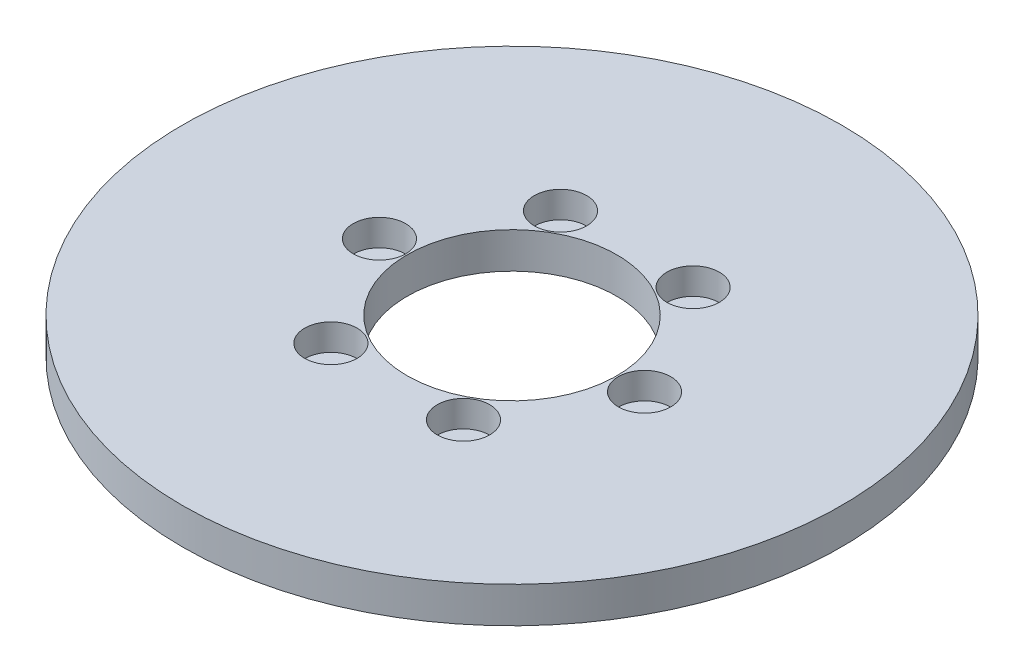
from build123d import *

# Parameters (mm, degrees)
SKETCH1_R           = 55
BOSS_EXTRUDE1_DEPTH = 6
SKETCH2_R           = 17.5
CUT_EXTRUDE1_DEPTH  = 79.012819459
SKETCH3_R           = 4.37630442
CUT_EXTRUDE2_DEPTH  = 4.409124383
CIRPATTERN1_COUNT   = 6


with BuildPart() as part:
    # Sketch1 → Boss-Extrude1 (new body)
    with BuildSketch(Plane(origin=(0, 0, 0), x_dir=(1, 0, 0), z_dir=(0, 1, 0))):
        Circle(SKETCH1_R)
    extrude(amount=BOSS_EXTRUDE1_DEPTH)

    # Sketch2 → Cut-Extrude1 (cut, through all)
    with BuildSketch(Plane(origin=(0, 0, 0), x_dir=(1, 0, 0), z_dir=(0, 1, 0))):
        Circle(SKETCH2_R)
    extrude(amount=CUT_EXTRUDE1_DEPTH, mode=Mode.SUBTRACT)

    # Sketch3 → Cut-Extrude2 (cut)
    with BuildSketch(Plane(origin=(0, 6, 0), x_dir=(1, 0, 0), z_dir=(0, 1, 0))):
        with Locations((-22.122792646, 0)):
            Circle(SKETCH3_R)
    cut_extrude2 = extrude(amount=-CUT_EXTRUDE2_DEPTH, mode=Mode.SUBTRACT)

    # CirPattern1: Cut-Extrude2 ×6 about axis
    cirpattern1_axis = Axis((0, 0, 0), (0, 1, 0))
    for i in range(1, CIRPATTERN1_COUNT):
        add(cut_extrude2.rotate(cirpattern1_axis, i * 360 / CIRPATTERN1_COUNT), mode=Mode.SUBTRACT)


solid = part.part
